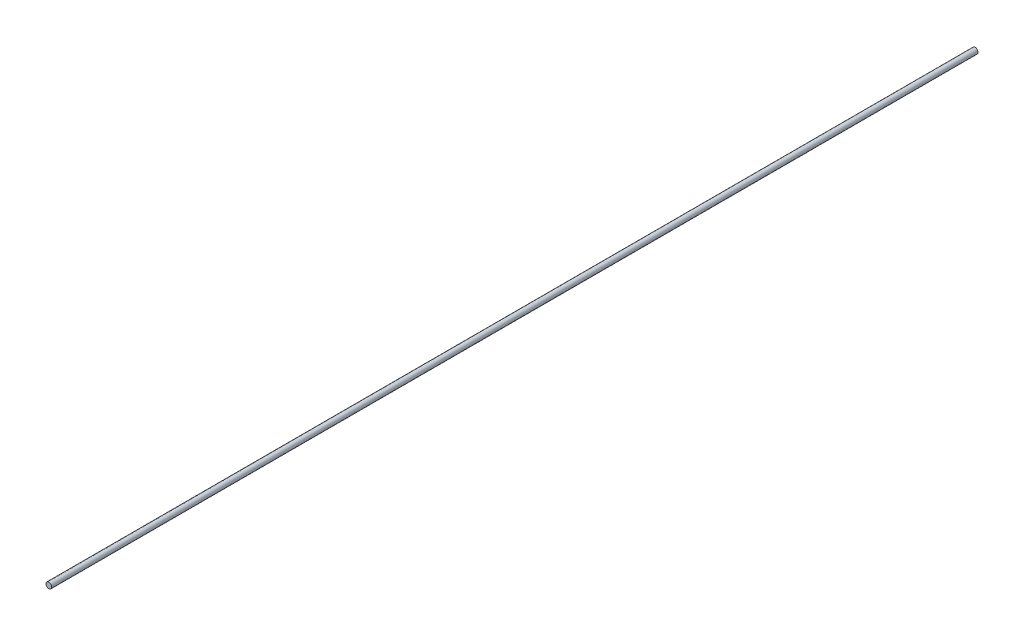
from build123d import *

# Parameters (mm, degrees)
SKETCH1_R = 2.5
ROD_DEPTH = 814


with BuildPart() as part:
    # Sketch1 → Rod (new body)
    with BuildSketch(Plane.XY):
        Circle(SKETCH1_R)
    extrude(amount=ROD_DEPTH)


solid = part.part
